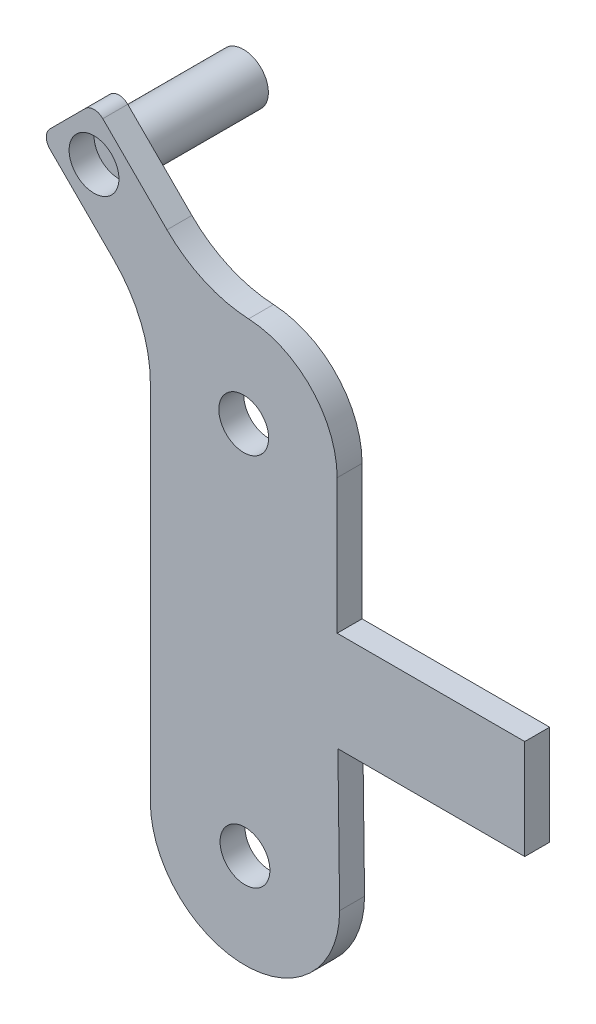
from build123d import *

# Parameters (mm, degrees)
SKETCH1_R           = 2
BOSS_EXTRUDE1_DEPTH = 2
SKETCH2_R           = 2
BOSS_EXTRUDE2_DEPTH = 10


with BuildPart() as part:
    # Sketch1 → Boss-Extrude1 (new body)
    with BuildSketch(Plane.XY):
        with BuildLine():
            Line((2.20562545, -13.407760963), (2.069353309, -2.407760963))
            Line((2.069353309, -2.407760963), (17.069353309, -2.407760963))
            Line((17.069353309, -2.407760963), (17.069353309, 5.592239037))
            Line((17.069353309, 5.592239037), (2.007957865, 5.592239037))
            Line((2.007957865, 5.592239037), (2.007957865, 16.40396461))
            ThreePointArc((2.007957865, 16.40396461), (-0.052844017, 21.567793019), (-5.102741824, 23.893854146))
            ThreePointArc((-5.102741824, 23.893854146), (-8.649077723, 24.74404502), (-11.654742555, 26.809305716))
            Line((-11.654742555, 26.809305716), (-16.805750634, 31.960313796))
            ThreePointArc((-16.805750634, 31.960313796), (-17.512857416, 32.253207015), (-18.219964197, 31.960313796))
            Line((-18.219964197, 31.960313796), (-21.048391322, 29.131886671))
            ThreePointArc((-21.048391322, 29.131886671), (-21.34128454, 28.42477989), (-21.048391322, 27.717673109))
            Line((-21.048391322, 27.717673109), (-15.920974324, 22.590256111))
            ThreePointArc((-15.920974324, 22.590256111), (-13.75324681, 19.346022623), (-12.992042135, 15.519188299))
            Line((-12.992042135, 15.519188299), (-12.992042135, -13.59603539))
            ThreePointArc((-12.992042135, -13.59603539), (-5.392042135, -21.19603539), (2.207957865, -13.59603539))
            Line((2.207957865, -13.59603539), (2.20562545, -13.407760963))
        make_face()
        with Locations((-5.392042135, -13.59603539)):
            Circle(SKETCH1_R, mode=Mode.SUBTRACT)
        with Locations((-5.492042135, 16.40396461)):
            Circle(SKETCH1_R, mode=Mode.SUBTRACT)
        with Locations((-17.512857416, 28.42477989)):
            Circle(SKETCH1_R, mode=Mode.SUBTRACT)
    extrude(amount=BOSS_EXTRUDE1_DEPTH)


with BuildPart() as body_2:
    # Sketch2 → Boss-Extrude2 (new body)
    with BuildSketch(Plane(origin=(0, 0, 0), x_dir=(-1, 0, 0), z_dir=(0, 0, -1))):
        with Locations((17.512857416, 28.42477989)):
            Circle(SKETCH2_R)
    extrude(amount=BOSS_EXTRUDE2_DEPTH)


solid = Compound([part.part, body_2.part])
